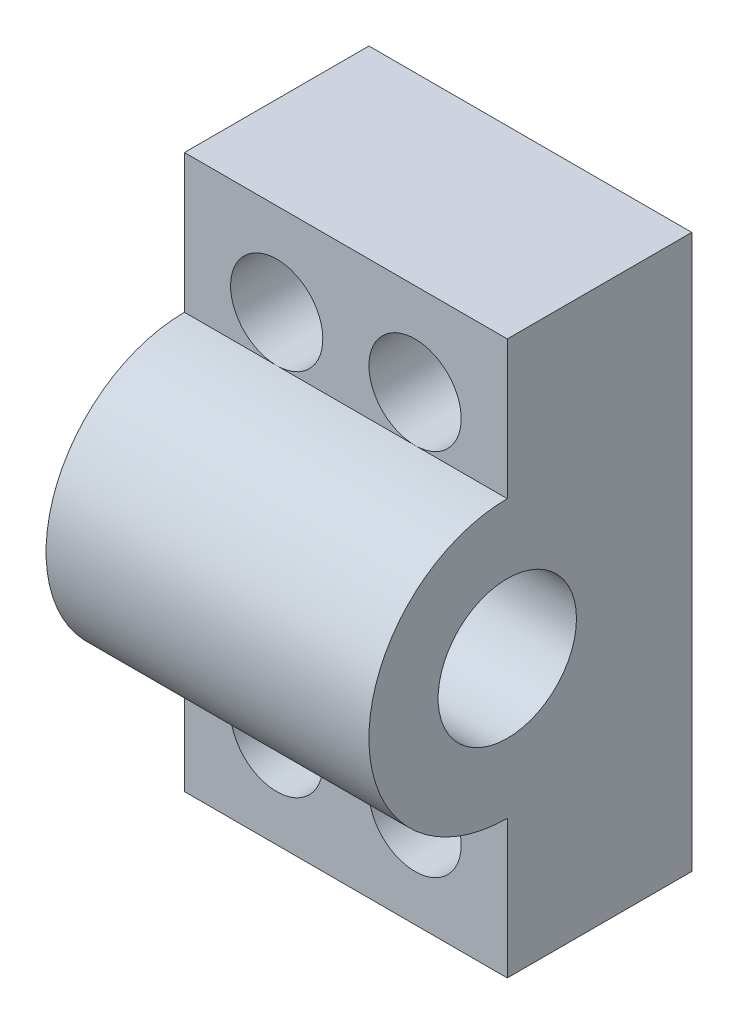
from build123d import *

# Parameters (mm, degrees)
BODY_DEPTH         = 35
SKETCH2_R          = 5
FIXING_HOLES_DEPTH = 58.879184514
SKETCH3_R          = 7.5
SHAFT_HOLE_DEPTH   = 40


with BuildPart() as part:
    # Sketch1 → body (new body)
    with BuildSketch(Plane(origin=(0, 0, 0), x_dir=(0, 0, -1), z_dir=(1, 0, 0))):
        with BuildLine():
            Line((0, -30), (0, 30))
            Line((0, 30), (-20, 30))
            Line((-20, 30), (-20, 15))
            ThreePointArc((-20, 15), (-35, 0), (-20, -15))
            Line((-20, -15), (-20, -30))
            Line((-20, -30), (0, -30))
        make_face()
    extrude(amount=BODY_DEPTH)

    # Sketch2 → fixing holes (cut, through all)
    with BuildSketch(Plane.XY):
        with Locations((10, 20)):
            Circle(SKETCH2_R)
        with Locations((25, 20)):
            Circle(SKETCH2_R)
        with Locations((10, -20)):
            Circle(SKETCH2_R)
        with Locations((25, -20)):
            Circle(SKETCH2_R)
    extrude(amount=FIXING_HOLES_DEPTH, mode=Mode.SUBTRACT)

    # Sketch3 → shaft hole (cut)
    with BuildSketch(Plane(origin=(35, 0, 0), x_dir=(0, 0, -1), z_dir=(1, 0, 0))):
        with Locations((-20, 0)):
            Circle(SKETCH3_R)
    extrude(amount=-SHAFT_HOLE_DEPTH, mode=Mode.SUBTRACT)


solid = part.part
